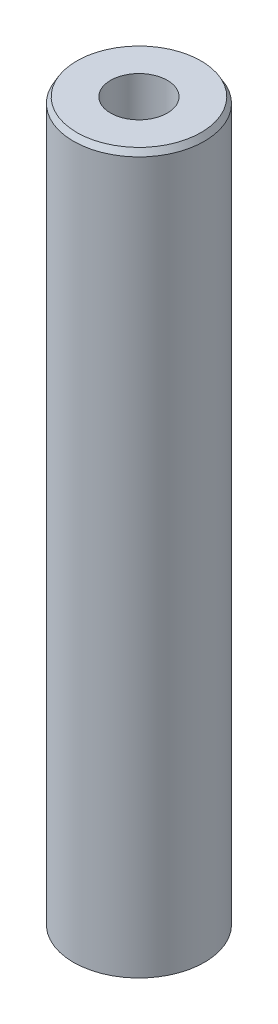
from build123d import *
from OCP.BRepFilletAPI import BRepFilletAPI_MakeChamfer

# Parameters (mm, degrees)
SKETCH1_R           = 7.5
BOSS_EXTRUDE1_DEPTH = 82.5000005
SKETCH2_R           = 3.251497039
CUT_EXTRUDE1_DEPTH  = 84.179024294
CHAMFER1_SIZE       = 0.671543354
CHAMFER1_SIZE2      = 0.387715736


with BuildPart() as part:
    # Sketch1 → Boss-Extrude1 (new body)
    with BuildSketch(Plane(origin=(0, 0, 0), x_dir=(1, 0, 0), z_dir=(0, 1, 0))):
        Circle(SKETCH1_R)
    extrude(amount=BOSS_EXTRUDE1_DEPTH)

    # Sketch2 → Cut-Extrude1 (cut, through all)
    with BuildSketch(Plane(origin=(0, 0, 0), x_dir=(1, 0, 0), z_dir=(0, 1, 0))):
        Circle(SKETCH2_R)
    extrude(amount=CUT_EXTRUDE1_DEPTH, mode=Mode.SUBTRACT)

    # Chamfer1: one chamfer whose edges measure the first distance from different faces: ONE call of the kernel's chamfer builder (chamfer() names one face for all edges)
    chamfer1_edges_1 = [part.edges().sort_by_distance(p)[0] for p in [
        (-7.5, 82.5000005, 0),
    ]]
    chamfer1_side_1 = [part.faces().sort_by_distance(p)[0] for p in [
        (-7.5, 41.25000025, 0),
    ]]
    chamfer1_edges_2 = [part.edges().sort_by_distance(p)[0] for p in [
        (-7.5, 0, 0),
    ]]
    chamfer1_side_2 = [part.faces().sort_by_distance(p)[0] for p in [
        (-7.287867966, 0, 0),
    ]]
    chamfer1 = BRepFilletAPI_MakeChamfer(part.part.solid().wrapped)
    for e in chamfer1_edges_1:
        chamfer1.Add(CHAMFER1_SIZE, CHAMFER1_SIZE2, e.wrapped, chamfer1_side_1[0].wrapped)  # the first distance lies on this face
    for e in chamfer1_edges_2:
        chamfer1.Add(CHAMFER1_SIZE, CHAMFER1_SIZE2, e.wrapped, chamfer1_side_2[0].wrapped)  # the first distance lies on this face
    add(Compound.cast(chamfer1.Shape()), mode=Mode.REPLACE)


solid = part.part
